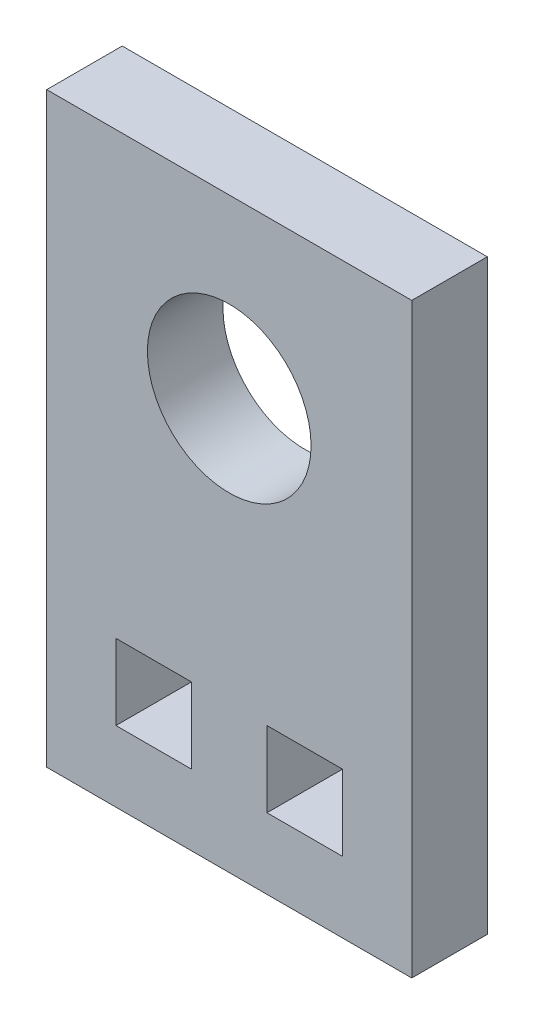
from build123d import *

# Parameters (mm, degrees)
SKETCH1_R           = 3.25
SKETCH1_W           = 3
SKETCH1_H           = 3
BOSS_EXTRUDE1_DEPTH = 3


with BuildPart() as part:
    # Sketch1 → Boss-Extrude1 (new body)
    with BuildSketch(Plane.XY):
        Polygon((-7.206431168, -7.130585607), (-7.206431168, 13.369414393), (7.293568832, 13.369414393), (7.293568832, -6.939685402), (7.293568832, -9.939685402), (-7.206431168, -9.939685402), align=None)
        with Locations((0.043568832, 6.369414393)):
            Circle(SKETCH1_R, mode=Mode.SUBTRACT)
        with Locations((-2.956431168, -5.630585607)):
            Rectangle(SKETCH1_W, SKETCH1_H, mode=Mode.SUBTRACT)
        with Locations((3.043568832, -5.630585607)):
            Rectangle(SKETCH1_W, SKETCH1_H, mode=Mode.SUBTRACT)
    extrude(amount=BOSS_EXTRUDE1_DEPTH)


solid = part.part
